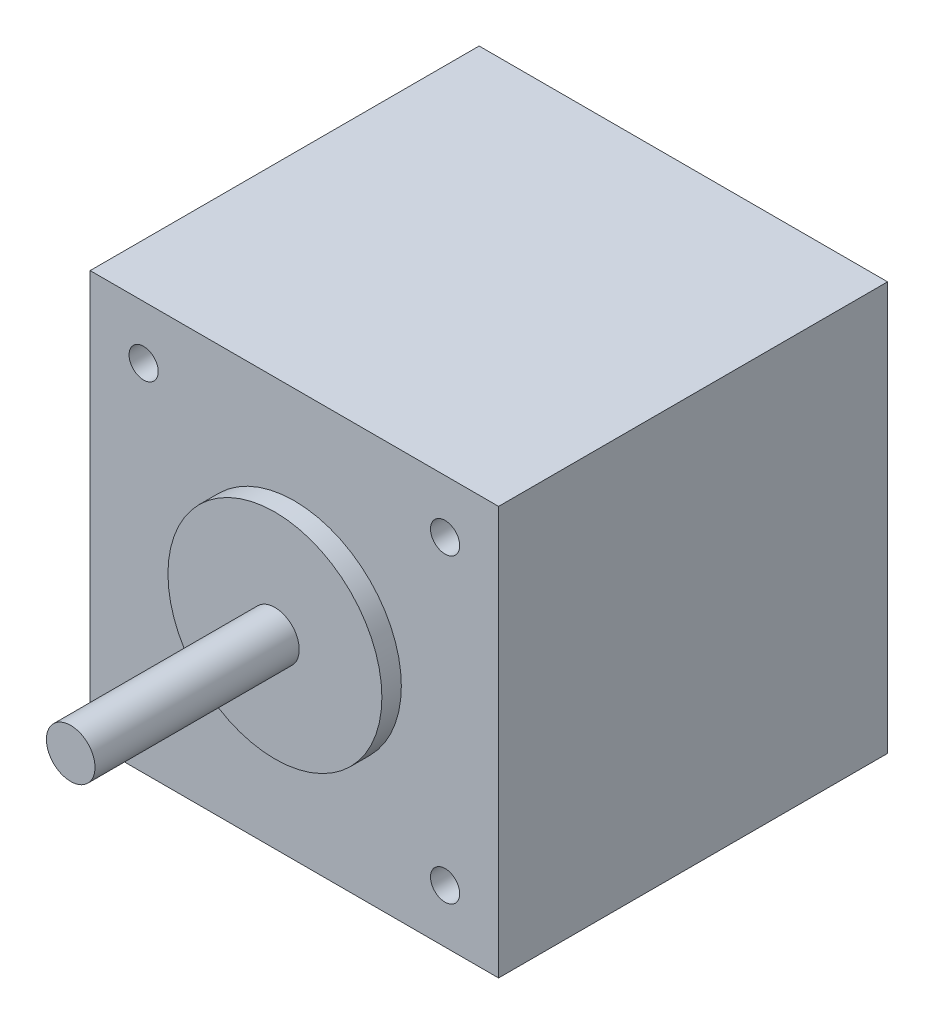
from build123d import *

# Parameters (mm, degrees)
SKETCH_1_W          = 42
SKETCH_1_H          = 42
EXTRUDE_1262_DEPTH  = 40
SKETCH_2_R          = 2.5
EXTRUDE_1317_DEPTH  = 63
SKETCH_3_R          = 11
EXTRUDE_1364_DEPTH  = 42
CUT_EXTRUDE_START   = 40
SKETCH_4_R          = 1.5
CUT_EXTRUDE_3_DEPTH = 4.5


with BuildPart() as part:
    # Эскиз1 → Extrude 1262 (new body)
    with BuildSketch(Plane.XY):
        Rectangle(SKETCH_1_W, SKETCH_1_H)
    extrude(amount=EXTRUDE_1262_DEPTH)

    # Эскиз2 → Extrude 1317 (add)
    with BuildSketch(Plane.XY):
        Circle(SKETCH_2_R)
    extrude(amount=EXTRUDE_1317_DEPTH)

    # Эскиз3 → Extrude 1364 (add)
    with BuildSketch(Plane.XY):
        Circle(SKETCH_3_R)
    extrude(amount=EXTRUDE_1364_DEPTH)

    # Эскиз4 → Крепеж_М3_ПРЕДВ (cut)
    with BuildSketch(Plane.XY.offset(CUT_EXTRUDE_START)):
        with Locations((-15.5, -15.5)):
            Circle(SKETCH_4_R)
        with Locations((-15.5, 15.5)):
            Circle(SKETCH_4_R)
        with Locations((15.5, -15.5)):
            Circle(SKETCH_4_R)
        with Locations((15.5, 15.5)):
            Circle(SKETCH_4_R)
    extrude(amount=-CUT_EXTRUDE_3_DEPTH, mode=Mode.SUBTRACT)


solid = part.part
